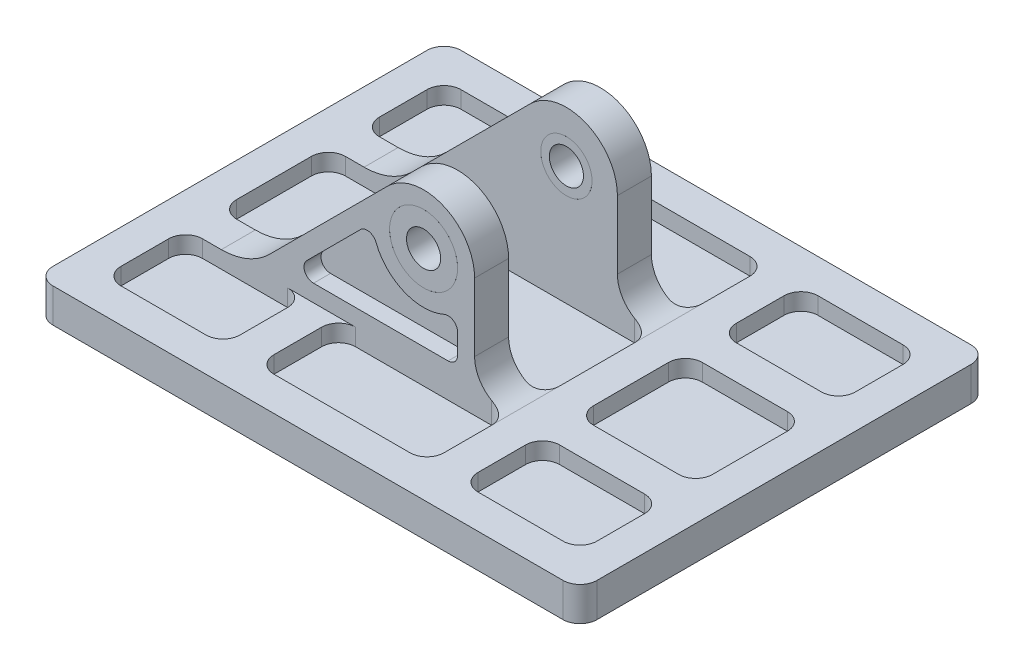
from build123d import *

# Parameters (mm, degrees)
SKETCH1_W                                        = 101.6
SKETCH1_H                                        = 76.2
BOSS_EXTRUDE1_DEPTH                              = 6.35
SKETCH2_R                                        = 4.7879
BOSS_EXTRUDE2_DEPTH                              = 6.35
SKETCH3_W                                        = 88.9
SKETCH3_H                                        = 20.32
SKETCH3_H_2                                      = 15.24
CUT_EXTRUDE1_DEPTH                               = 3.175
RIB1_START                                       = -3.175
RIB1_OUTLINE_W                                   = 6.35
RIB1_OUTLINE_H                                   = 20.32
RIB1_OUTLINE_H_2                                 = 15.24
RIB1_DEPTH                                       = 3.175
FILLET1_R                                        = 12.7
FILLET2_R                                        = 3.175
FILLET5_R                                        = 6.35
CUT_EXTRUDE2_DEPTH                               = 1.016
LPATTERN1_COUNT                                  = 29
LPATTERN1_PITCH                                  = 3.175
CUT_EXTRUDE3_DEPTH                               = 3.175
FILLET4_R                                        = 1.778
FILLET4_OF_MIRROR3_R                             = 1.778
SKETCH8_R                                        = 6.35
CUT_EXTRUDE4_DEPTH                               = 1.5875
F_1677K100_OIL_EMBEDDED_START                    = 25.720954778
F_1677K100_OIL_EMBEDDED_FLANGED_SLEEVE_2_R       = 4.7879
F_1677K100_OIL_EMBEDDED_FLANGED_SLEEVE_2_R_2     = 3.1877
F_1677K100_OIL_EMBEDDED_FLANGED_SLEEVE_BEA_DEPTH = 6.35
F_1677K100_OIL_EMBEDDED_FLANGED_SLEEVE_3_O_R     = 6.35
F_1677K100_OIL_EMBEDDED_FLANGED_SLEEVE_3_O_R_2   = 4.7879
F_1677K100_OIL_EMBEDDED_FLANGED_SLEEVE_3_DEPTH   = 1.5875
BODY_MOVE_COPY2_ANGLE                            = 90
F_1677K100_OIL_EMBEDDED_FLANGED_SLEEVE_4_ANGLE   = 180


with BuildPart() as part:
    # Sketch1 → Boss-Extrude1 (new body)
    with BuildSketch(Plane(origin=(0, 0, 0), x_dir=(1, 0, 0), z_dir=(0, 1, 0))):
        Rectangle(SKETCH1_W, SKETCH1_H)
    extrude(amount=BOSS_EXTRUDE1_DEPTH)

    # Sketch2 → Boss-Extrude2 (add)
    with BuildSketch(Plane.XY.offset(10.16)):
        with BuildLine():
            ThreePointArc((6.735192091, 32.135192091), (0, 34.925), (-6.735192091, 32.135192091))
            Line((-6.735192091, 32.135192091), (-32.520384182, 6.35))
            Line((-32.520384182, 6.35), (9.525, 6.35))
            Line((9.525, 6.35), (9.525, 25.4))
            ThreePointArc((9.525, 25.4), (8.799952547, 29.045059693), (6.735192091, 32.135192091))
        make_face()
        with Locations((0, 25.4)):
            Circle(SKETCH2_R, mode=Mode.SUBTRACT)
    boss_extrude2 = extrude(amount=BOSS_EXTRUDE2_DEPTH)

    # Mirror1: Boss-Extrude2 across plane
    add(boss_extrude2.mirror(Plane.XY))

    # Sketch3 → Cut-Extrude1 (cut)
    with BuildSketch(Plane(origin=(0, 6.35, 0), x_dir=(1, 0, 0), z_dir=(0, 1, 0))):
        Rectangle(SKETCH3_W, SKETCH3_H)
        with Locations((0, 24.13)):
            Rectangle(SKETCH3_W, SKETCH3_H_2)
        with Locations((0, -24.13)):
            Rectangle(SKETCH3_W, SKETCH3_H_2)
    extrude(amount=-CUT_EXTRUDE1_DEPTH, mode=Mode.SUBTRACT)

    # Rib1: read off the stored shape, not the designer's step
    # Rib1 outline → Rib1 (add)
    with BuildSketch(Plane(origin=(0, 6.35, 0), x_dir=(1, 0, 0), z_dir=(0, 1, 0)).offset(RIB1_START)):
        with Locations((-19.05, 0)):
            Rectangle(RIB1_OUTLINE_W, RIB1_OUTLINE_H)
        with Locations((19.05, 0)):
            Rectangle(RIB1_OUTLINE_W, RIB1_OUTLINE_H)
        with Locations((-19.05, 24.13)):
            Rectangle(RIB1_OUTLINE_W, RIB1_OUTLINE_H_2)
        with Locations((19.05, 24.13)):
            Rectangle(RIB1_OUTLINE_W, RIB1_OUTLINE_H_2)
        with Locations((-19.05, -24.13)):
            Rectangle(RIB1_OUTLINE_W, RIB1_OUTLINE_H_2)
        with Locations((19.05, -24.13)):
            Rectangle(RIB1_OUTLINE_W, RIB1_OUTLINE_H_2)
    extrude(amount=RIB1_DEPTH)

    # Fillet1
    fillet1_edges = [part.edges().sort_by_distance(p)[0] for p in [
        (-32.520384182, 6.35, 13.335),
        (-32.520384182, 6.35, -13.335),
    ]]
    fillet(fillet1_edges, radius=FILLET1_R)

    # Fillet2
    fillet2_edges = [part.edges().sort_by_distance(p)[0] for p in [
        (-15.875, 4.7625, -10.16),
        (-15.875, 4.7625, 10.16),
        (-15.875, 4.7625, -16.51),
        (-22.225, 4.7625, 10.16),
        (-22.225, 4.7625, -10.16),
        (-22.225, 4.7625, 16.51),
        (-22.225, 4.7625, -16.51),
        (-22.225, 4.7625, -31.75),
        (-15.875, 4.7625, -31.75),
        (-15.875, 4.7625, 16.51),
        (-15.875, 4.7625, 31.75),
        (-22.225, 4.7625, 31.75),
        (22.225, 4.7625, -10.16),
        (22.225, 4.7625, 10.16),
        (22.225, 4.7625, -16.51),
        (15.875, 4.7625, 10.16),
        (15.875, 4.7625, -10.16),
        (15.875, 4.7625, 16.51),
        (15.875, 4.7625, -16.51),
        (15.875, 4.7625, -31.75),
        (22.225, 4.7625, -31.75),
        (22.225, 4.7625, 16.51),
        (22.225, 4.7625, 31.75),
        (15.875, 4.7625, 31.75),
        (-44.45, 4.7625, 31.75),
        (-44.45, 4.7625, 16.51),
        (44.45, 4.7625, 16.51),
        (44.45, 4.7625, 31.75),
        (-44.45, 4.7625, -16.51),
        (-44.45, 4.7625, -31.75),
        (44.45, 4.7625, -31.75),
        (44.45, 4.7625, -16.51),
        (-44.45, 4.7625, 10.16),
        (-44.45, 4.7625, -10.16),
        (44.45, 4.7625, -10.16),
        (44.45, 4.7625, 10.16),
        (50.8, 3.175, 38.1),
        (-50.8, 3.175, 38.1),
        (-50.8, 3.175, -38.1),
        (50.8, 3.175, -38.1),
    ]]
    fillet(fillet2_edges, radius=FILLET2_R)

    # Fillet5
    fillet5_edges = [part.edges().sort_by_distance(p)[0] for p in [
        (9.525, 6.35, -13.335),
        (9.525, 6.35, 13.335),
    ]]
    fillet(fillet5_edges, radius=FILLET5_R - 0.0001)  # a hair under: the kernel refuses the full size

    # Sketch6 → Cut-Extrude2 (cut)
    with BuildSketch(Plane.XZ):
        with BuildLine():
            Line((-43.688, 33.3375), (-43.688, -33.3375))
            ThreePointArc((-43.688, -33.3375), (-44.45, -34.0995), (-45.212, -33.3375))
            Line((-45.212, -33.3375), (-45.212, 33.3375))
            ThreePointArc((-45.212, 33.3375), (-44.45, 34.0995), (-43.688, 33.3375))
        make_face()
    cut_extrude2 = extrude(amount=-CUT_EXTRUDE2_DEPTH, mode=Mode.SUBTRACT)

    # LPattern1: Cut-Extrude2 ×29
    with Locations(*[(i * LPATTERN1_PITCH, 0, 0) for i in range(1, LPATTERN1_COUNT)]):
        add(cut_extrude2, mode=Mode.SUBTRACT)

    # Sketch7 → Cut-Extrude3 (cut)
    with BuildSketch(Plane.XY.offset(16.51)):
        with BuildLine():
            Line((6.35, 18.300484171), (6.35, 9.525))
            Line((6.35, 9.525), (-24.855256121, 9.525))
            Line((-24.855256121, 9.525), (-9.510243846, 24.870012275))
            ThreePointArc((-9.510243846, 24.870012275), (-3.645059693, 16.600047453), (6.35, 18.300484171))
        make_face()
    cut_extrude3 = extrude(amount=-CUT_EXTRUDE3_DEPTH, mode=Mode.SUBTRACT)

    # Fillet4
    fillet4_edges = [part.edges().sort_by_distance(p)[0] for p in [
        (6.35, 9.525, 14.9225),
        (-24.855256121, 9.525, 14.9225),
        (-9.510243846, 24.870012275, 14.9225),
        (6.35, 18.300484171, 14.9225),
    ]]
    fillet(fillet4_edges, radius=FILLET4_R)

    # Mirror3: Cut-Extrude3 across plane
    add(cut_extrude3.mirror(Plane.XY), mode=Mode.SUBTRACT)

    # Fillet4 of Mirror3
    fillet4_of_mirror3_edges = [part.edges().sort_by_distance(p)[0] for p in [
        (6.35, 9.525, -14.9225),
        (-24.855256121, 9.525, -14.9225),
        (-9.510243846, 24.870012275, -14.9225),
        (6.35, 18.300484171, -14.9225),
    ]]
    fillet(fillet4_of_mirror3_edges, radius=FILLET4_OF_MIRROR3_R)

    # Sketch8 → Cut-Extrude4 (cut)
    with BuildSketch(Plane.XY.offset(16.51)):
        with Locations((0, 25.4)):
            Circle(SKETCH8_R)
    cut_extrude4 = extrude(amount=-CUT_EXTRUDE4_DEPTH, mode=Mode.SUBTRACT)

    # Mirror4: Cut-Extrude4 across plane
    add(cut_extrude4.mirror(Plane.XY), mode=Mode.SUBTRACT)


with BuildPart() as body_2:
    # 1677K100_OIL-EMBEDDED FLANGED SLEEVE BEA: read off the stored shape, not the designer's step
    # 1677K100_OIL-EMBEDDED FLANGED SLEEVE 2 → 1677K100_OIL-EMBEDDED FLANGED SLEEVE BEA (new body)
    with BuildSketch(Plane(origin=(0, 0, 0), x_dir=(1, 0, 0), z_dir=(0, 1, 0)).offset(F_1677K100_OIL_EMBEDDED_START)):
        with Locations((27.998481552, -19.074630867)):
            Circle(F_1677K100_OIL_EMBEDDED_FLANGED_SLEEVE_2_R)
        with Locations((27.998481552, -19.074630867)):
            Circle(F_1677K100_OIL_EMBEDDED_FLANGED_SLEEVE_2_R_2, mode=Mode.SUBTRACT)
    extrude(amount=F_1677K100_OIL_EMBEDDED_FLANGED_SLEEVE_BEA_DEPTH)

    # 1677K100_OIL-EMBEDDED FLANGED SLEEVE 3 o → 1677K100_OIL-EMBEDDED FLANGED SLEEVE 3 (add)
    with BuildSketch(Plane(origin=(0, 0, 0), x_dir=(1, 0, 0), z_dir=(0, 1, 0)).offset(F_1677K100_OIL_EMBEDDED_START)):
        with Locations((27.998481552, -19.074630867)):
            Circle(F_1677K100_OIL_EMBEDDED_FLANGED_SLEEVE_3_O_R)
        with Locations((27.998481552, -19.074630867)):
            Circle(F_1677K100_OIL_EMBEDDED_FLANGED_SLEEVE_3_O_R_2, mode=Mode.SUBTRACT)
    extrude(amount=F_1677K100_OIL_EMBEDDED_FLANGED_SLEEVE_3_DEPTH)


with BuildPart() as body_2_1:
    # Body-Move/Copy2: read off the stored shape, not the designer's step
    # Body-Move/Copy2: moved
    add(body_2.part.moved(Location((-27.9984816, -42.2309548, 6.3253691))).rotate(Axis((0, 0, 0), (-1, 0, 0)), BODY_MOVE_COPY2_ANGLE))


with BuildPart() as body_3:
    # 1677K100_OIL-EMBEDDED FLANGED SLEEVE 4: read off the stored shape, not the designer's step
    # 1677K100_OIL-EMBEDDED FLANGED SLEEVE 4: copy of body 2
    add(body_2_1.part.moved(Location((0, -50.8, 0))).rotate(Axis((0, 0, 0), (1, 0, 0)), F_1677K100_OIL_EMBEDDED_FLANGED_SLEEVE_4_ANGLE))


solid = Compound([part.part, body_2_1.part, body_3.part])
